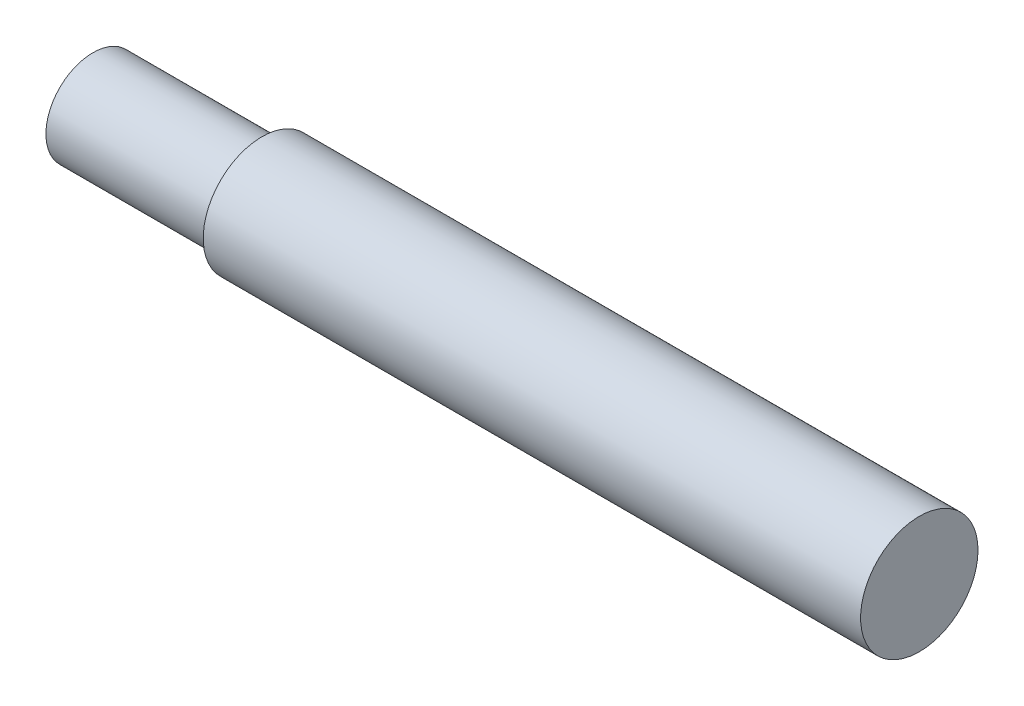
from build123d import *

# Parameters (mm, degrees)
SKETCH2_R           = 3.96875
BOSS_EXTRUDE1_DEPTH = 44.45
SKETCH3_R           = 3.175
BOSS_EXTRUDE2_DEPTH = 11.43


with BuildPart() as part:
    # Sketch2 → Boss-Extrude1 (new body)
    with BuildSketch(Plane(origin=(0, 0, 0), x_dir=(0, 0, -1), z_dir=(1, 0, 0))):
        Circle(SKETCH2_R)
    extrude(amount=BOSS_EXTRUDE1_DEPTH)

    # Sketch3 → Boss-Extrude2 (add)
    with BuildSketch(Plane(origin=(0, 0, 0), x_dir=(0, 0, -1), z_dir=(1, 0, 0))):
        Circle(SKETCH3_R)
    extrude(amount=-BOSS_EXTRUDE2_DEPTH)


solid = part.part
